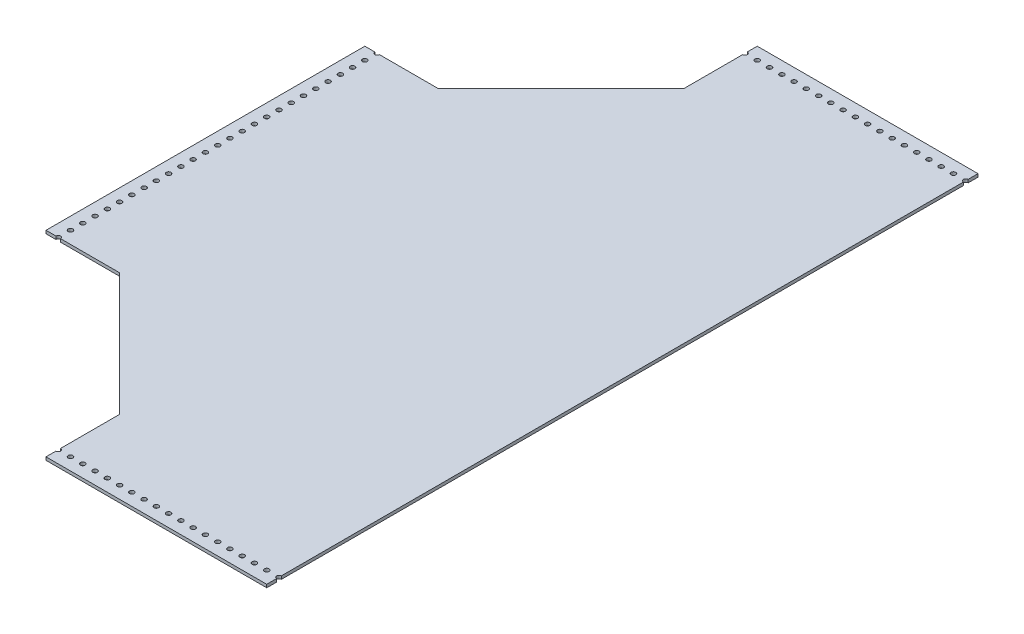
from build123d import *

# Parameters (mm, degrees)
SKETCH1_W                  = 635
SKETCH1_H                  = 736.6
BASE_DEPTH                 = 3.175
SKETCH3_R                  = 2.413
INITIAL_PATTERN_HOLE_DEPTH = 487.272784171
HOLE_PATTERN_1_COUNT       = 58
HOLE_PATTERN_1_PITCH       = 12.7
HOLE_PATTERN_2_OUTLINE_R   = 2.413
HOLE_PATTERN_2_DEPTH       = 3.175
SKETCH4_W                  = 203.2
SKETCH4_H                  = 736.6
TOP_MODULE_CUTOUT_DEPTH    = 487.272784171


# Read off the part's stored shape, not the designer's step: Hole Pattern 2
with BuildPart() as part:
    # Sketch1 → Base (new body)
    with BuildSketch(Plane(origin=(0, 0, 0), x_dir=(1, 0, 0), z_dir=(0, 1, 0))):
        Rectangle(SKETCH1_W, SKETCH1_H)
    extrude(amount=BASE_DEPTH)

    # Sketch3 → Initial Pattern Hole (cut, through all)
    with BuildSketch(Plane(origin=(0, 3.175, 0), x_dir=(1, 0, 0), z_dir=(0, 1, 0))):
        with Locations(Location((-304.8, 355.6, 0), (0, 0, 270))):
            Circle(SKETCH3_R)
        with Locations(Location((304.8, 355.6, 0), (0, 0, 270))):
            Circle(SKETCH3_R)
    initial_pattern_hole = extrude(amount=-INITIAL_PATTERN_HOLE_DEPTH, mode=Mode.SUBTRACT)

    # Hole Pattern 1: Initial Pattern Hole ×58
    with Locations(*[(0, 0, i * HOLE_PATTERN_1_PITCH) for i in range(1, HOLE_PATTERN_1_COUNT)]):
        add(initial_pattern_hole, mode=Mode.SUBTRACT)

    # Hole Pattern 2 outline → Hole Pattern 2 (cut)
    with BuildSketch(Plane(origin=(0, 0, 0), x_dir=(1, 0, 0), z_dir=(0, 1, 0))):
        with Locations((292.1, 355.6)):
            Circle(HOLE_PATTERN_2_OUTLINE_R)
        with Locations((292.1, -355.6)):
            Circle(HOLE_PATTERN_2_OUTLINE_R)
        with Locations((279.4, 355.6)):
            Circle(HOLE_PATTERN_2_OUTLINE_R)
        with Locations((279.4, -355.6)):
            Circle(HOLE_PATTERN_2_OUTLINE_R)
        with Locations((266.7, 355.6)):
            Circle(HOLE_PATTERN_2_OUTLINE_R)
        with Locations((266.7, -355.6)):
            Circle(HOLE_PATTERN_2_OUTLINE_R)
        with Locations((254, 355.6)):
            Circle(HOLE_PATTERN_2_OUTLINE_R)
        with Locations((254, -355.6)):
            Circle(HOLE_PATTERN_2_OUTLINE_R)
        with Locations((241.3, 355.6)):
            Circle(HOLE_PATTERN_2_OUTLINE_R)
        with Locations((241.3, -355.6)):
            Circle(HOLE_PATTERN_2_OUTLINE_R)
        with Locations((228.6, 355.6)):
            Circle(HOLE_PATTERN_2_OUTLINE_R)
        with Locations((228.6, -355.6)):
            Circle(HOLE_PATTERN_2_OUTLINE_R)
        with Locations((215.9, 355.6)):
            Circle(HOLE_PATTERN_2_OUTLINE_R)
        with Locations((215.9, -355.6)):
            Circle(HOLE_PATTERN_2_OUTLINE_R)
        with Locations((203.2, 355.6)):
            Circle(HOLE_PATTERN_2_OUTLINE_R)
        with Locations((203.2, -355.6)):
            Circle(HOLE_PATTERN_2_OUTLINE_R)
        with Locations((190.5, 355.6)):
            Circle(HOLE_PATTERN_2_OUTLINE_R)
        with Locations((190.5, -355.6)):
            Circle(HOLE_PATTERN_2_OUTLINE_R)
        with Locations((177.8, 355.6)):
            Circle(HOLE_PATTERN_2_OUTLINE_R)
        with Locations((177.8, -355.6)):
            Circle(HOLE_PATTERN_2_OUTLINE_R)
        with Locations((165.1, 355.6)):
            Circle(HOLE_PATTERN_2_OUTLINE_R)
        with Locations((165.1, -355.6)):
            Circle(HOLE_PATTERN_2_OUTLINE_R)
        with Locations((152.4, 355.6)):
            Circle(HOLE_PATTERN_2_OUTLINE_R)
        with Locations((152.4, -355.6)):
            Circle(HOLE_PATTERN_2_OUTLINE_R)
        with Locations((139.7, 355.6)):
            Circle(HOLE_PATTERN_2_OUTLINE_R)
        with Locations((139.7, -355.6)):
            Circle(HOLE_PATTERN_2_OUTLINE_R)
        with Locations((127, 355.6)):
            Circle(HOLE_PATTERN_2_OUTLINE_R)
        with Locations((127, -355.6)):
            Circle(HOLE_PATTERN_2_OUTLINE_R)
        with Locations((114.3, 355.6)):
            Circle(HOLE_PATTERN_2_OUTLINE_R)
        with Locations((114.3, -355.6)):
            Circle(HOLE_PATTERN_2_OUTLINE_R)
        with Locations((101.6, 355.6)):
            Circle(HOLE_PATTERN_2_OUTLINE_R)
        with Locations((101.6, -355.6)):
            Circle(HOLE_PATTERN_2_OUTLINE_R)
        with Locations((88.9, 355.6)):
            Circle(HOLE_PATTERN_2_OUTLINE_R)
        with Locations((88.9, -355.6)):
            Circle(HOLE_PATTERN_2_OUTLINE_R)
        with Locations((76.2, 355.6)):
            Circle(HOLE_PATTERN_2_OUTLINE_R)
        with Locations((76.2, -355.6)):
            Circle(HOLE_PATTERN_2_OUTLINE_R)
        with Locations((63.5, 355.6)):
            Circle(HOLE_PATTERN_2_OUTLINE_R)
        with Locations((63.5, -355.6)):
            Circle(HOLE_PATTERN_2_OUTLINE_R)
        with Locations((50.8, 355.6)):
            Circle(HOLE_PATTERN_2_OUTLINE_R)
        with Locations((50.8, -355.6)):
            Circle(HOLE_PATTERN_2_OUTLINE_R)
        with Locations((38.1, 355.6)):
            Circle(HOLE_PATTERN_2_OUTLINE_R)
        with Locations((38.1, -355.6)):
            Circle(HOLE_PATTERN_2_OUTLINE_R)
        with Locations((25.4, 355.6)):
            Circle(HOLE_PATTERN_2_OUTLINE_R)
        with Locations((25.4, -355.6)):
            Circle(HOLE_PATTERN_2_OUTLINE_R)
        with Locations((12.7, 355.6)):
            Circle(HOLE_PATTERN_2_OUTLINE_R)
        with Locations((12.7, -355.6)):
            Circle(HOLE_PATTERN_2_OUTLINE_R)
        with Locations((0, 355.6)):
            Circle(HOLE_PATTERN_2_OUTLINE_R)
        with Locations((0, -355.6)):
            Circle(HOLE_PATTERN_2_OUTLINE_R)
        with Locations((-12.7, 355.6)):
            Circle(HOLE_PATTERN_2_OUTLINE_R)
        with Locations((-12.7, -355.6)):
            Circle(HOLE_PATTERN_2_OUTLINE_R)
        with Locations((-25.4, 355.6)):
            Circle(HOLE_PATTERN_2_OUTLINE_R)
        with Locations((-25.4, -355.6)):
            Circle(HOLE_PATTERN_2_OUTLINE_R)
        with Locations((-38.1, 355.6)):
            Circle(HOLE_PATTERN_2_OUTLINE_R)
        with Locations((-38.1, -355.6)):
            Circle(HOLE_PATTERN_2_OUTLINE_R)
        with Locations((-50.8, 355.6)):
            Circle(HOLE_PATTERN_2_OUTLINE_R)
        with Locations((-50.8, -355.6)):
            Circle(HOLE_PATTERN_2_OUTLINE_R)
        with Locations((-63.5, 355.6)):
            Circle(HOLE_PATTERN_2_OUTLINE_R)
        with Locations((-63.5, -355.6)):
            Circle(HOLE_PATTERN_2_OUTLINE_R)
        with Locations((-76.2, 355.6)):
            Circle(HOLE_PATTERN_2_OUTLINE_R)
        with Locations((-76.2, -355.6)):
            Circle(HOLE_PATTERN_2_OUTLINE_R)
        with Locations((-88.9, 355.6)):
            Circle(HOLE_PATTERN_2_OUTLINE_R)
        with Locations((-88.9, -355.6)):
            Circle(HOLE_PATTERN_2_OUTLINE_R)
        with Locations((-101.6, 355.6)):
            Circle(HOLE_PATTERN_2_OUTLINE_R)
        with Locations((-101.6, -355.6)):
            Circle(HOLE_PATTERN_2_OUTLINE_R)
        with Locations((-114.3, 355.6)):
            Circle(HOLE_PATTERN_2_OUTLINE_R)
        with Locations((-114.3, -355.6)):
            Circle(HOLE_PATTERN_2_OUTLINE_R)
        with Locations((-127, 355.6)):
            Circle(HOLE_PATTERN_2_OUTLINE_R)
        with Locations((-127, -355.6)):
            Circle(HOLE_PATTERN_2_OUTLINE_R)
        with Locations((-139.7, 355.6)):
            Circle(HOLE_PATTERN_2_OUTLINE_R)
        with Locations((-139.7, -355.6)):
            Circle(HOLE_PATTERN_2_OUTLINE_R)
        with Locations((-152.4, 355.6)):
            Circle(HOLE_PATTERN_2_OUTLINE_R)
        with Locations((-152.4, -355.6)):
            Circle(HOLE_PATTERN_2_OUTLINE_R)
        with Locations((-165.1, 355.6)):
            Circle(HOLE_PATTERN_2_OUTLINE_R)
        with Locations((-165.1, -355.6)):
            Circle(HOLE_PATTERN_2_OUTLINE_R)
        with Locations((-177.8, 355.6)):
            Circle(HOLE_PATTERN_2_OUTLINE_R)
        with Locations((-177.8, -355.6)):
            Circle(HOLE_PATTERN_2_OUTLINE_R)
        with Locations((-190.5, 355.6)):
            Circle(HOLE_PATTERN_2_OUTLINE_R)
        with Locations((-190.5, -355.6)):
            Circle(HOLE_PATTERN_2_OUTLINE_R)
        with Locations((-203.2, 355.6)):
            Circle(HOLE_PATTERN_2_OUTLINE_R)
        with Locations((-203.2, -355.6)):
            Circle(HOLE_PATTERN_2_OUTLINE_R)
        with Locations((-215.9, 355.6)):
            Circle(HOLE_PATTERN_2_OUTLINE_R)
        with Locations((-215.9, -355.6)):
            Circle(HOLE_PATTERN_2_OUTLINE_R)
        with Locations((-228.6, 355.6)):
            Circle(HOLE_PATTERN_2_OUTLINE_R)
        with Locations((-228.6, -355.6)):
            Circle(HOLE_PATTERN_2_OUTLINE_R)
        with Locations((-241.3, 355.6)):
            Circle(HOLE_PATTERN_2_OUTLINE_R)
        with Locations((-241.3, -355.6)):
            Circle(HOLE_PATTERN_2_OUTLINE_R)
        with Locations((-254, 355.6)):
            Circle(HOLE_PATTERN_2_OUTLINE_R)
        with Locations((-254, -355.6)):
            Circle(HOLE_PATTERN_2_OUTLINE_R)
        with Locations((-266.7, 355.6)):
            Circle(HOLE_PATTERN_2_OUTLINE_R)
        with Locations((-266.7, -355.6)):
            Circle(HOLE_PATTERN_2_OUTLINE_R)
        with Locations((-279.4, 355.6)):
            Circle(HOLE_PATTERN_2_OUTLINE_R)
        with Locations((-279.4, -355.6)):
            Circle(HOLE_PATTERN_2_OUTLINE_R)
        with Locations((-292.1, 355.6)):
            Circle(HOLE_PATTERN_2_OUTLINE_R)
        with Locations((-292.1, -355.6)):
            Circle(HOLE_PATTERN_2_OUTLINE_R)
    extrude(amount=HOLE_PATTERN_2_DEPTH, mode=Mode.SUBTRACT)

    # Sketch4 → Top Module Cutout (cut, through all)
    with BuildSketch(Plane(origin=(0, 3.175, 0), x_dir=(1, 0, 0), z_dir=(0, 1, 0))):
        Polygon((-317.5, 165.1), (-241.3, 165.1), (-114.3, 292.1), (-114.3, 368.3), (-317.5, 368.3), align=None)
        Polygon((-317.5, -368.3), (-114.3, -368.3), (-114.3, -292.1), (-241.3, -165.1), (-317.5, -165.1), align=None)
        with Locations((215.9, 0)):
            Rectangle(SKETCH4_W, SKETCH4_H)
    extrude(amount=-TOP_MODULE_CUTOUT_DEPTH, mode=Mode.SUBTRACT)


solid = part.part
